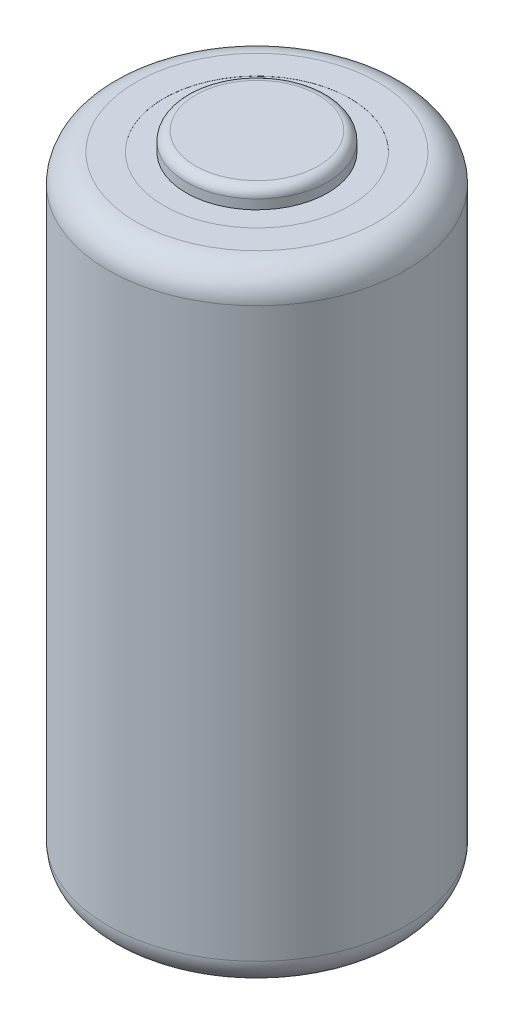
from build123d import *

# Parameters (mm, degrees)
SKIZZE1_R                       = 8
AUFSATZ_LINEAR_AUSTRAGEN1_DEPTH = 33.5
SKIZZE2_R                       = 3.799988553
AUFSATZ_LINEAR_AUSTRAGEN2_DEPTH = 1
VERRUNDUNG1_R                   = 1.5
VERRUNDUNG2_R                   = 0.5
SCHNITT_LINEAR_START            = -0.005
SKIZZE3_R                       = 5
SKIZZE3_R_2                     = 3.799988553
SCHNITT_LINEAR_AUSTRAGEN1_DEPTH = 0.005


with BuildPart() as part:
    # Skizze1 → Aufsatz-Linear austragen1 (new body)
    with BuildSketch(Plane(origin=(0, 0, 0), x_dir=(1, 0, 0), z_dir=(0, 1, 0))):
        Circle(SKIZZE1_R)
    extrude(amount=AUFSATZ_LINEAR_AUSTRAGEN1_DEPTH)

    # Skizze2 → Aufsatz-Linear austragen2 (add)
    with BuildSketch(Plane(origin=(0, 33.5, 0), x_dir=(1, 0, 0), z_dir=(0, 1, 0))):
        Circle(SKIZZE2_R)
    extrude(amount=AUFSATZ_LINEAR_AUSTRAGEN2_DEPTH)

    # Verrundung1
    verrundung1_edges = [part.edges().sort_by_distance(p)[0] for p in [
        (-8, 0, 0),
        (-8, 33.5, 0),
    ]]
    fillet(verrundung1_edges, radius=VERRUNDUNG1_R)

    # Verrundung2
    verrundung2_edges = [part.edges().sort_by_distance(p)[0] for p in [
        (-3.799988553, 34.5, 0),
    ]]
    fillet(verrundung2_edges, radius=VERRUNDUNG2_R)

    # Skizze3 → Schnitt-Linear austragen1 (cut)
    with BuildSketch(Plane(origin=(0, 33.5, 0), x_dir=(1, 0, 0), z_dir=(0, 1, 0)).offset(SCHNITT_LINEAR_START)):
        Circle(SKIZZE3_R)
        Circle(SKIZZE3_R_2, mode=Mode.SUBTRACT)
    extrude(amount=SCHNITT_LINEAR_AUSTRAGEN1_DEPTH, mode=Mode.SUBTRACT)


solid = part.part
